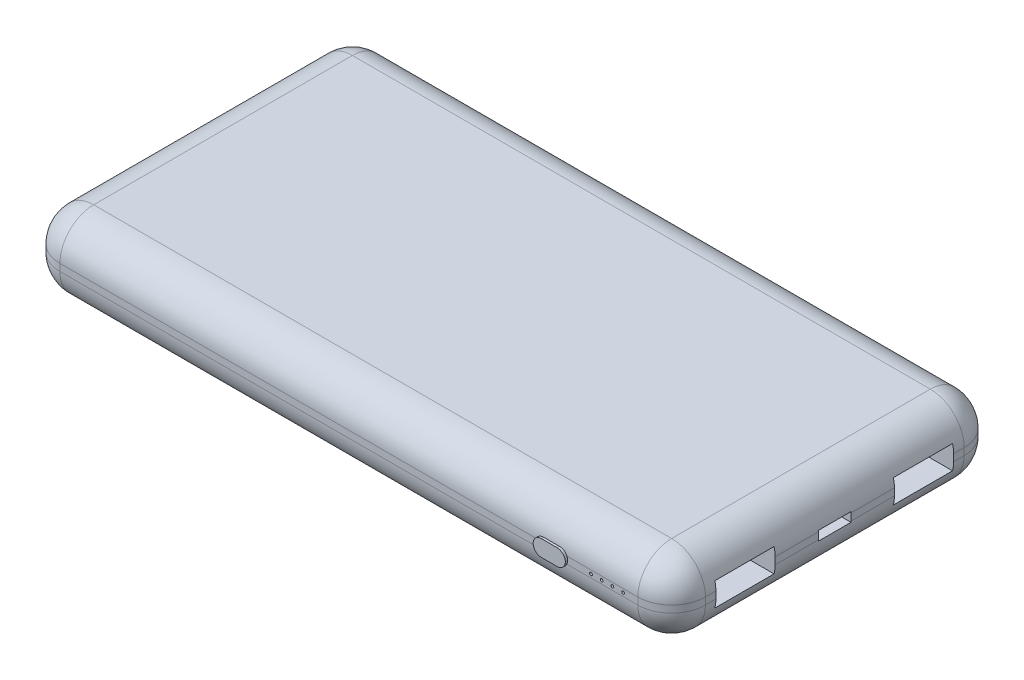
from build123d import *

# Parameters (mm, degrees)
SKETCH1_W                  = 138.5
SKETCH1_H                  = 70
BOSS_EXTRUDE1_DEPTH        = 8
FILLET1_R                  = 7.25
SKETCH3_W                  = 12.7
SKETCH3_H                  = 5.08
USB_A_DEPTH                = 11.25
SKETCH4_W                  = 7
SKETCH4_H                  = 2
USB_MICRO_NOTTOSCALE_DEPTH = 5
SKETCH5_W                  = 8.382
SKETCH5_H                  = 2.54
USB_C_DEPTH                = 8
FILLET2_R                  = 1.27
SKETCH6_W                  = 6.9
SKETCH6_H                  = 3.5
BATTERY_LEVEL_DEPTH        = 0.5
FILLET3_R                  = 1.75
SKETCH7_R                  = 0.3
BATTERY_LIGHTS_DEPTH       = 1


# Some blends are built 0.0001 mm under size
with BuildPart() as part:
    # Sketch1 → Boss-Extrude1 (new, symmetric)
    with BuildSketch(Plane(origin=(0, 0, 0), x_dir=(1, 0, 0), z_dir=(0, 1, 0))):
        Rectangle(SKETCH1_W, SKETCH1_H)
    extrude(amount=BOSS_EXTRUDE1_DEPTH, both=True)

    # Fillet1
    fillet1_edges = [part.edges().sort_by_distance(p)[0] for p in [
        (-69.25, 8, 0),
        (0, 8, 35),
        (69.25, 8, 0),
        (0, -8, 35),
        (-69.25, -8, 0),
        (0, -8, -35),
        (69.25, -8, 0),
        (69.25, 0, 35),
        (-69.25, 0, 35),
        (-69.25, 0, -35),
        (69.25, 0, -35),
        (0, 8, -35),
    ]]
    fillet(fillet1_edges, radius=FILLET1_R)

    # Sketch3 → USB-A (cut)
    with BuildSketch(Plane(origin=(69.25, 0, 0), x_dir=(0, 0, -1), z_dir=(1, 0, 0))):
        with Locations((-19.15, 0)):
            Rectangle(SKETCH3_W, SKETCH3_H)
        with Locations((19.15, 0)):
            Rectangle(SKETCH3_W, SKETCH3_H)
    extrude(amount=-USB_A_DEPTH, mode=Mode.SUBTRACT)

    # Sketch4 → USB-micro-NOTtoSCALE (cut)
    with BuildSketch(Plane(origin=(69.25, 0, 0), x_dir=(0, 0, -1), z_dir=(1, 0, 0))):
        Rectangle(SKETCH4_W, SKETCH4_H)
    extrude(amount=-USB_MICRO_NOTTOSCALE_DEPTH, mode=Mode.SUBTRACT)

    # Sketch5 → USB-C (cut)
    with BuildSketch(Plane(origin=(0, 0, -35), x_dir=(-1, 0, 0), z_dir=(0, 0, -1))):
        with Locations((-46.009, 0)):
            Rectangle(SKETCH5_W, SKETCH5_H)
    extrude(amount=-USB_C_DEPTH, mode=Mode.SUBTRACT)

    # Fillet2
    fillet2_edges = [part.edges().sort_by_distance(p)[0] for p in [
        (41.818, 1.27, -30.990663839),
        (41.818, -1.27, -30.990663839),
        (50.2, -1.27, -30.990663839),
        (50.2, 1.27, -30.990663839),
    ]]
    fillet(fillet2_edges, radius=FILLET2_R - 0.0001)  # a hair under: the kernel refuses the full size

    # Sketch6 → battery level (add)
    with BuildSketch(Plane.XY.offset(35)):
        with Locations((43.49, 0)):
            Rectangle(SKETCH6_W, SKETCH6_H)
    extrude(amount=BATTERY_LEVEL_DEPTH)

    # Fillet3
    # the kernel refuses this fillet: 1.75 mm, written as the material it takes off along each edge
    with BuildSketch(Plane(origin=(40.04, -1.75, 35), x_dir=(0, 1, 0), z_dir=(0, 0, 1))) as fillet3_piece_1:
        with BuildLine():
            CenterArc((FILLET3_R, -FILLET3_R), FILLET3_R, 90, 90)
            Line((0, -FILLET3_R), (0, 0))
            Line((0, 0), (FILLET3_R, 0))
        make_face()
    extrude(amount=4.875, mode=Mode.SUBTRACT)
    with BuildSketch(Plane(origin=(40.04, 1.75, 35), x_dir=(0, -1, 0), z_dir=(0, 0, 1)), Plane(origin=(46.94, -1.75, 35), x_dir=(0, 1, 0), z_dir=(0, 0, 1)), Plane(origin=(46.94, 1.75, 35), x_dir=(-1, 0, 0), z_dir=(0, 0, 1))) as fillet3_piece_2:
        with BuildLine():
            CenterArc((FILLET3_R, FILLET3_R), FILLET3_R, 180, 90)
            Line((0, FILLET3_R), (0, 0))
            Line((0, 0), (FILLET3_R, 0))
        make_face()
    extrude(amount=4.875, mode=Mode.SUBTRACT)

    # Sketch7 → battery lights (cut)
    with BuildSketch(Plane.XY.offset(35)):
        with Locations((51.94, 0)):
            Circle(SKETCH7_R)
        with Locations((54.24, 0)):
            Circle(SKETCH7_R)
        with Locations((56.54, 0)):
            Circle(SKETCH7_R)
        with Locations((58.84, 0)):
            Circle(SKETCH7_R)
    extrude(amount=-BATTERY_LIGHTS_DEPTH, mode=Mode.SUBTRACT)


solid = part.part
